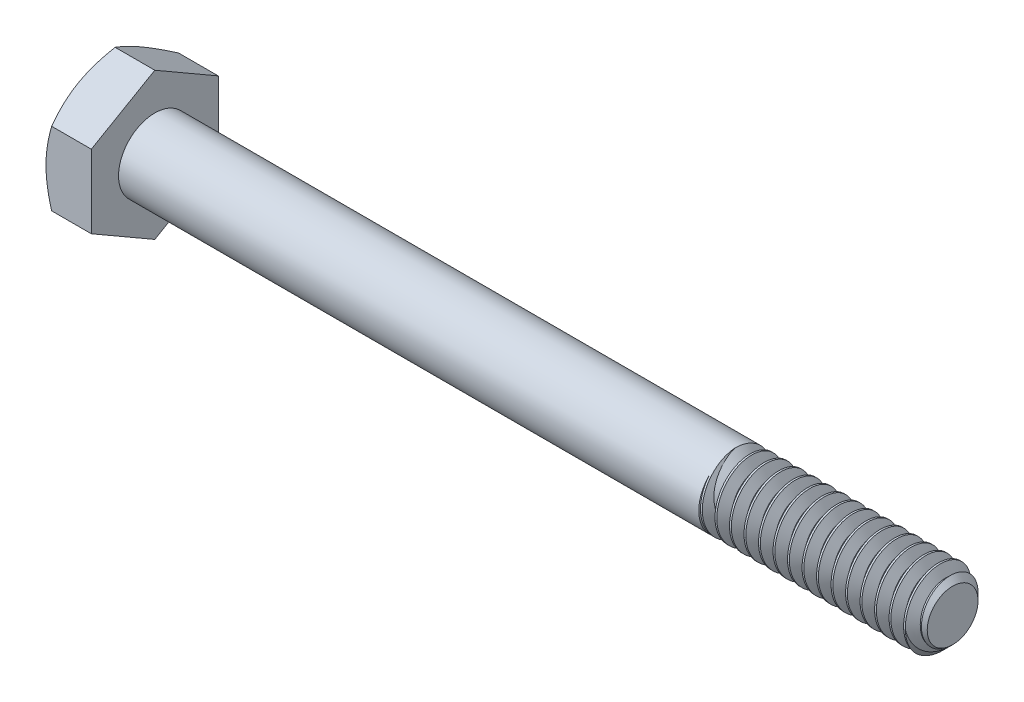
from build123d import *

# Parameters (mm, degrees)
SKETCH5_R           = 3.175
BOSS_EXTRUDE3_DEPTH = 69.85
CHAMFER1_SIZE       = 0.9525
CUT_SWEEP1_PITCH    = 1.27
BOSS_EXTRUDE4_DEPTH = 3.96875
SKETCH8_OUTSIDE_W   = 289.126
SKETCH8_OUTSIDE_H   = 290.846
SKETCH8_OUTSIDE_R   = 5.55625
CUT_EXTRUDE3_DEPTH  = 75.30506263
CUT_EXTRUDE3_DRAFT  = -60


with BuildPart() as part:
    # Sketch5 → Boss-Extrude3 (new body)
    with BuildSketch(Plane(origin=(36.909375, 0, 0), x_dir=(0, 0, -1), z_dir=(1, 0, 0))):
        Circle(SKETCH5_R)
    extrude(amount=-BOSS_EXTRUDE3_DEPTH)

    # Chamfer1
    chamfer1_edges = [part.edges().sort_by_distance(p)[0] for p in [
        (36.909375, 0, 3.175),
    ]]
    chamfer(chamfer1_edges, length=CHAMFER1_SIZE)

    # Cut-Sweep1: the profile of Sketch10 profile screwed along a right-hand helix of 16 turns, 8 arcs to a turn; built about Z, then put on its axis
    cut_sweep1_z = Axis((0, 0, 0), (0, 0, 1))
    cut_sweep1_corners = [(3.1753, 0, 0.000173205), (2.350110803, 0, -0.47625), (2.350110803, 0, -0.635), (3.1753, 0, -1.111423205)]
    with BuildLine(mode=Mode.PRIVATE) as cut_sweep1_profile:
        Line(cut_sweep1_corners[0], cut_sweep1_corners[1])
        Line(cut_sweep1_corners[1], cut_sweep1_corners[2])
        Line(cut_sweep1_corners[2], cut_sweep1_corners[3])
        Line(cut_sweep1_corners[3], cut_sweep1_corners[0])
    cut_sweep1_cap = Face(cut_sweep1_profile.wire())
    cut_sweep1_turn_angles = [0, 22.5, 45, 67.5, 90, 112.5, 135, 157.5, 180, 202.5, 225, 247.5, 270, 292.5, 315, 337.5, 360]
    cut_sweep1_turn_weights = [1, 0.9238795325112867, 1, 0.9238795325112867, 1, 0.9238795325112867, 1, 0.9238795325112867, 1, 0.9238795325112867, 1, 0.9238795325112867, 1, 0.9238795325112867, 1, 0.9238795325112867, 1]
    cut_sweep1_turn_rails = [Edge.make_bspline([Vector(p[0], p[1], 0).rotate(cut_sweep1_z, cut_sweep1_turn_angles[k]) / cut_sweep1_turn_weights[k] + Vector(0, 0, p[2] + CUT_SWEEP1_PITCH * cut_sweep1_turn_angles[k] / 360) for k in range(17)], [0, 0, 0, 1, 1, 2, 2, 3, 3, 4, 4, 5, 5, 6, 6, 7, 7, 8, 8, 8], 2, cut_sweep1_turn_weights) for p in cut_sweep1_corners]
    cut_sweep1_turn_sides = [Face.make_surface_from_curves(cut_sweep1_turn_rails[p[0]], cut_sweep1_turn_rails[p[1]]) for p in [(0, 1), (1, 2), (2, 3), (3, 0)]]
    cut_sweep1 = Plane(origin=(36.909375, 0, 0), x_dir=(0, 1, 0), z_dir=(-1, 0, 0)) * Solid(Shell([*[p.moved(Location((0, 0, CUT_SWEEP1_PITCH * i))) for i in range(16) for p in cut_sweep1_turn_sides], cut_sweep1_cap, cut_sweep1_cap.rotate(cut_sweep1_z, 5760).moved(Location((0, 0, CUT_SWEEP1_PITCH * 5760 / 360)))]))
    add(cut_sweep1, mode=Mode.SUBTRACT)

    # Sketch11 → Revolve1 (revolve)
    with BuildSketch(Plane.XY, mode=Mode.PRIVATE) as revolve1_sk:
        Polygon((-32.940625, 3.175), (-32.940625, 0), (21.034375, 0), (17.859375, 3.175), align=None)
    revolve(revolve1_sk.sketch.rotate(Axis((-32.940625, 0, 0), (1, 0, 0)), 270), axis=Axis((-32.940625, 0, 0), (1, 0, 0)))

    # Sketch6 → Boss-Extrude4 (add)
    with BuildSketch(Plane.ZY.offset(32.940625)):
        Polygon((5.55625, 3.207902433), (0, 6.415804866), (-5.55625, 3.207902433), (-5.55625, -3.207902433), (0, -6.415804866), (5.55625, -3.207902433), align=None)
    extrude(amount=BOSS_EXTRUDE4_DEPTH)


with BuildPart() as cut_extrude3_tool:
    # Sketch8 outside → Cut-Extrude3 (with draft: the straight prism first)
    with BuildSketch(Plane.ZY.offset(36.909375)):
        Rectangle(SKETCH8_OUTSIDE_W, SKETCH8_OUTSIDE_H)
        Circle(SKETCH8_OUTSIDE_R, mode=Mode.SUBTRACT)
    extrude(amount=-CUT_EXTRUDE3_DEPTH)
    # Cut-Extrude3: the draft: its side faces are tilted about the plane it starts from
    cut_extrude3_sides = [cut_extrude3_tool.faces().sort_by_distance(p)[0] for p in [
        (0.743156315, -145.423, 0),
        (0.743156315, 0, 144.563),
        (0.743156315, 145.423, 0),
        (0.743156315, 0, -144.563),
        (0.743156315, 0, -5.55625),
    ]]
    draft(cut_extrude3_sides, Plane.ZY.offset(36.909375), CUT_EXTRUDE3_DRAFT)


with BuildPart() as part_1:
    add(part.part)

    # Cut-Extrude3: cut by cut_extrude3_tool
    add(cut_extrude3_tool.part, mode=Mode.SUBTRACT)


solid = part_1.part
